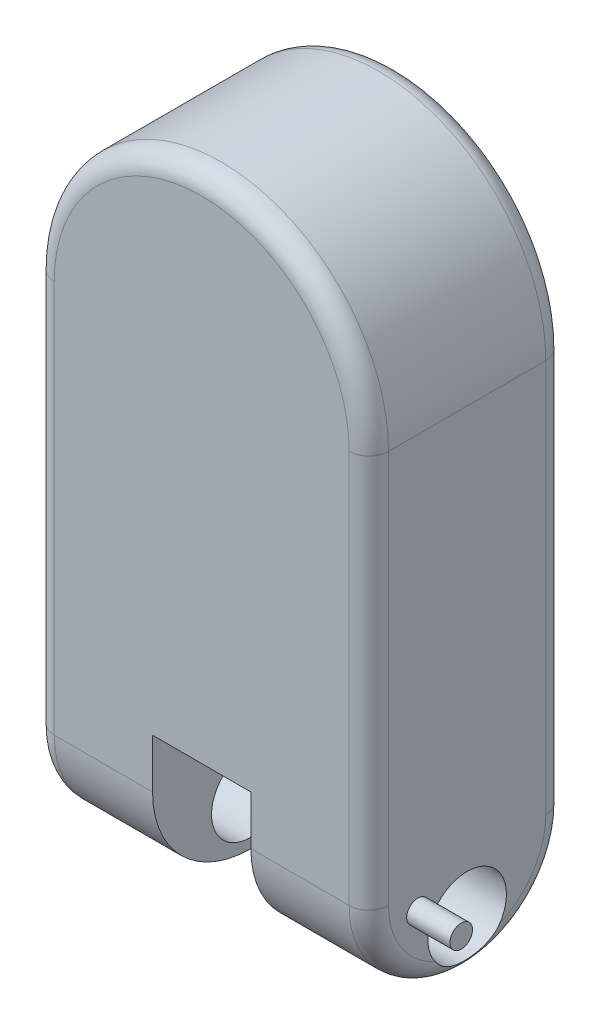
from build123d import *

# Parameters (mm, degrees)
BOSS_EXTRUDE1_DEPTH    = 100
SKETCH2_W              = 50
SKETCH2_H              = 50
CUT_EXTRUDE1_DEPTH     = 182.245689604
CUT_EXTRUDE2_DEPTH     = 25
SKETCH7_R              = 20
CUT_EXTRUDE3_DEPTH     = 234.505888577
FILLET2_R              = 50
CUT_EXTRUDE6_START     = -125
CUT_EXTRUDE6_OUTLINE_W = 50
CUT_EXTRUDE6_OUTLINE_H = 6.698729811
CUT_EXTRUDE6_DEPTH     = 50
CUT_EXTRUDE7_DEPTH     = 25
BOSS_EXTRUDE2_DEPTH    = 100
FILLET4_R              = 10
SKETCH11_W             = 50
SKETCH11_H             = 25
CUT_EXTRUDE11_DEPTH    = 99
SKETCH16_W             = 50
SKETCH16_H             = 30
BOSS_EXTRUDE3_DEPTH    = 0.1
FILLET5_R              = 10
SKETCH17_R             = 5.75
BOSS_EXTRUDE4_DEPTH    = 22


with BuildPart() as part:
    # Sketch1 → Boss-Extrude1 (new body)
    with BuildSketch(Plane.XY):
        Polygon((-85, 125), (10.2, 125), (59.8, 125), (85, 125), (85, -125), (-85, -125), align=None)
    extrude(amount=-BOSS_EXTRUDE1_DEPTH)

    # Sketch2 → Cut-Extrude1 (cut, through all)
    with BuildSketch(Plane.XY):
        with Locations((0, -125)):
            Rectangle(SKETCH2_W, SKETCH2_H)
    extrude(amount=-CUT_EXTRUDE1_DEPTH, mode=Mode.SUBTRACT)

    # Sketch6 → Cut-Extrude2 (cut, symmetric)
    with BuildSketch(Plane(origin=(0, 0, 0), x_dir=(0, 0, -1), z_dir=(1, 0, 0))):
        with BuildLine():
            Line((100, -100), (0, -100))
            ThreePointArc((0, -100), (50, -50), (100, -100))
        make_face()
    extrude(amount=CUT_EXTRUDE2_DEPTH, both=True, mode=Mode.SUBTRACT)

    # Sketch7 → Cut-Extrude3 (cut, through all)
    with BuildSketch(Plane.ZY.offset(85)):
        with Locations(Location((-50, -100, 0), (0, 0, 270))):
            Circle(SKETCH7_R)
    extrude(amount=-CUT_EXTRUDE3_DEPTH, mode=Mode.SUBTRACT)

    # Fillet2
    fillet2_edges = [part.edges().sort_by_distance(p)[0] for p in [
        (-55, -125, -100),
        (-55, -125, 0),
    ]]
    fillet(fillet2_edges, radius=FILLET2_R - 0.0001)  # a hair under: the kernel refuses the full size

    # Cut-Extrude6: read off the stored shape, not the designer's step
    # Cut-Extrude6 outline → Cut-Extrude6 (cut)
    with BuildSketch(Plane(origin=(0, 0, 0), x_dir=(1, 0, 0), z_dir=(0, 1, 0)).offset(CUT_EXTRUDE6_START)):
        with Locations((0, 96.650635095)):
            Rectangle(CUT_EXTRUDE6_OUTLINE_W, CUT_EXTRUDE6_OUTLINE_H)
        with Locations((0, 3.349364906)):
            Rectangle(CUT_EXTRUDE6_OUTLINE_W, CUT_EXTRUDE6_OUTLINE_H)
    extrude(amount=CUT_EXTRUDE6_DEPTH, mode=Mode.SUBTRACT)

    # Sketch10 → Cut-Extrude7 (cut, symmetric)
    with BuildSketch(Plane(origin=(0, 0, 0), x_dir=(0, 0, -1), z_dir=(1, 0, 0))):
        with BuildLine():
            Line((0, -75), (100, -75))
            ThreePointArc((100, -75), (50, -61.602540378), (0, -75))
        make_face()
    extrude(amount=CUT_EXTRUDE7_DEPTH, both=True, mode=Mode.SUBTRACT)

    # Sketch15 → Boss-Extrude2 (add)
    with BuildSketch(Plane.XY):
        with BuildLine():
            Line((-85, 125), (85, 125))
            ThreePointArc((85, 125), (0, 210), (-85, 125))
        make_face()
    extrude(amount=-BOSS_EXTRUDE2_DEPTH)

    # Fillet4
    # the kernel refuses this fillet: 10 mm, written as the material it takes off along each edge
    with BuildSketch(Plane(origin=(0, 125, -100), x_dir=(1, 0, 0), z_dir=(0, -1, 0))) as fillet4_piece_1:
        with BuildLine():
            CenterArc((85 - FILLET4_R, FILLET4_R), FILLET4_R, 270, 90)
            Line((85, FILLET4_R), (85, 0))
            Line((85, 0), (85 - FILLET4_R, 0))
        make_face()
    revolve(axis=Axis((0, 125, -100), (0, 0, 1)), revolution_arc=180, mode=Mode.SUBTRACT)
    with BuildSketch(Plane(origin=(0, 125, 0), x_dir=(1, 0, 0), z_dir=(0, -1, 0))) as fillet4_piece_2:
        with BuildLine():
            CenterArc((85 - FILLET4_R, -FILLET4_R), FILLET4_R, 0, 90)
            Line((85, -FILLET4_R), (85, 0))
            Line((85, 0), (85 - FILLET4_R, 0))
        make_face()
    revolve(axis=Axis((0, 125, 0), (0, 0, 1)), revolution_arc=180, mode=Mode.SUBTRACT)
    with BuildSketch(Plane(origin=(-85, -75.0001, -100), x_dir=(0, 0, 1), z_dir=(0, 1, 0)), Plane(origin=(85, 125, 0), x_dir=(-1, 0, 0), z_dir=(0, -1, 0))) as fillet4_piece_3:
        with BuildLine():
            CenterArc((FILLET4_R, FILLET4_R), FILLET4_R, 180, 90)
            Line((0, FILLET4_R), (0, 0))
            Line((0, 0), (FILLET4_R, 0))
        make_face()
    extrude(amount=200.0001, mode=Mode.SUBTRACT)
    with BuildSketch(Plane(origin=(85, 125, -100), x_dir=(-1, 0, 0), z_dir=(0, -1, 0)), Plane(origin=(-85, -75.0001, 0), x_dir=(0, 0, -1), z_dir=(0, 1, 0))) as fillet4_piece_4:
        with BuildLine():
            CenterArc((FILLET4_R, -FILLET4_R), FILLET4_R, 90, 90)
            Line((0, -FILLET4_R), (0, 0))
            Line((0, 0), (FILLET4_R, 0))
        make_face()
    extrude(amount=200.0001, mode=Mode.SUBTRACT)
    with BuildSketch(Plane(origin=(85, -75.0001, -49.9999), x_dir=(0, 0, 1), z_dir=(0, 1, 0))) as fillet4_piece_5:
        with BuildLine():
            CenterArc((49.9999 - FILLET4_R, -FILLET4_R), FILLET4_R, 0, 90)
            Line((49.9999 - FILLET4_R, 0), (49.9999, 0))
            Line((49.9999, 0), (49.9999, -FILLET4_R))
        make_face()
    revolve(axis=Axis((85, -75.0001, -49.9999), (1, 0, 0)), revolution_arc=90, mode=Mode.SUBTRACT)
    with BuildSketch(Plane(origin=(85, -75.0001, -50.0001), x_dir=(0, 0, -1), z_dir=(0, 1, 0))) as fillet4_piece_6:
        with BuildLine():
            CenterArc((49.9999 - FILLET4_R, FILLET4_R), FILLET4_R, 270, 90)
            Line((49.9999, FILLET4_R), (49.9999, 0))
            Line((49.9999, 0), (49.9999 - FILLET4_R, 0))
        make_face()
    revolve(axis=Axis((85, -75.0001, -50.0001), (-1, 0, 0)), revolution_arc=90, mode=Mode.SUBTRACT)
    with BuildSketch(Plane(origin=(-85, -75.0001, -49.9999), x_dir=(0, 0, 1), z_dir=(0, 1, 0))) as fillet4_piece_7:
        with BuildLine():
            CenterArc((49.9999 - FILLET4_R, FILLET4_R), FILLET4_R, 270, 90)
            Line((49.9999, FILLET4_R), (49.9999, 0))
            Line((49.9999, 0), (49.9999 - FILLET4_R, 0))
        make_face()
    revolve(axis=Axis((-85, -75.0001, -49.9999), (1, 0, 0)), revolution_arc=90, mode=Mode.SUBTRACT)
    with BuildSketch(Plane(origin=(-85, -75.0001, -50.0001), x_dir=(0, 0, -1), z_dir=(0, 1, 0))) as fillet4_piece_8:
        with BuildLine():
            CenterArc((49.9999 - FILLET4_R, -FILLET4_R), FILLET4_R, 0, 90)
            Line((49.9999, -FILLET4_R), (49.9999, 0))
            Line((49.9999, 0), (49.9999 - FILLET4_R, 0))
        make_face()
    revolve(axis=Axis((-85, -75.0001, -50.0001), (-1, 0, 0)), revolution_arc=90, mode=Mode.SUBTRACT)
    with BuildSketch(Plane(origin=(-85, -125, -49.9999), x_dir=(0, 1, 0), z_dir=(0, 0, -1))) as fillet4_piece_9:
        with BuildLine():
            CenterArc((FILLET4_R, FILLET4_R), FILLET4_R, 180, 90)
            Line((0, FILLET4_R), (0, 0))
            Line((0, 0), (FILLET4_R, 0))
        make_face()
    extrude(amount=0.0002, mode=Mode.SUBTRACT)
    with BuildSketch(Plane(origin=(85, -125, -49.9999), x_dir=(0, 1, 0), z_dir=(0, 0, -1))) as fillet4_piece_10:
        with BuildLine():
            CenterArc((FILLET4_R, -FILLET4_R), FILLET4_R, 90, 90)
            Line((0, -FILLET4_R), (0, 0))
            Line((0, 0), (FILLET4_R, 0))
        make_face()
    extrude(amount=0.0002, mode=Mode.SUBTRACT)

    # Sketch11 → Cut-Extrude11 (cut)
    with BuildSketch(Plane.XY):
        with Locations((0, -62.5)):
            Rectangle(SKETCH11_W, SKETCH11_H)
    extrude(amount=-CUT_EXTRUDE11_DEPTH, mode=Mode.SUBTRACT)

    # Sketch17 → Boss-Extrude4 (add)
    with BuildSketch(Plane(origin=(85, 0, 0), x_dir=(0, 0, -1), z_dir=(1, 0, 0))):
        with Locations(Location((25, -85, 0), (0, 0, 90))):
            Circle(SKETCH17_R)
    extrude(amount=BOSS_EXTRUDE4_DEPTH)


with BuildPart() as body_2:
    # Sketch16 → Boss-Extrude3 (new body)
    with BuildSketch(Plane(origin=(0, 0, -100), x_dir=(-1, 0, 0), z_dir=(0, 0, -1))):
        with Locations((0, -90)):
            Rectangle(SKETCH16_W, SKETCH16_H)
    extrude(amount=BOSS_EXTRUDE3_DEPTH)

    # Fillet5
    # the kernel refuses this fillet: 10 mm, written as the material it takes off along each edge
    with BuildSketch(Plane(origin=(25, -71.473316005, -100.1), x_dir=(0, 0, 1), z_dir=(0, -1, 0)), Plane(origin=(-25, -108.526683995, -100.1), x_dir=(0, 0, 1), z_dir=(0, 1, 0))) as fillet5_piece_1:
        with BuildLine():
            CenterArc((10, 1.410673598), FILLET5_R, 180, 8.109614456)
            Line((0, 1.410673598), (0, 0))
            Line((0, 0), (0.1, 0))
        make_face()
    extrude(amount=37.05336799, mode=Mode.SUBTRACT)
    with BuildSketch(Plane(origin=(28.526683995, -105, -100.1), x_dir=(0, 0, 1), z_dir=(-1, 0, 0))) as fillet5_piece_2:
        with BuildLine():
            CenterArc((10, 1.410673598), FILLET5_R, 180, 8.109614456)
            Line((0, 1.410673598), (0, 0))
            Line((0, 0), (0.1, 0))
        make_face()
    extrude(amount=57.05336799, mode=Mode.SUBTRACT)


solid = Compound([part.part, body_2.part])
